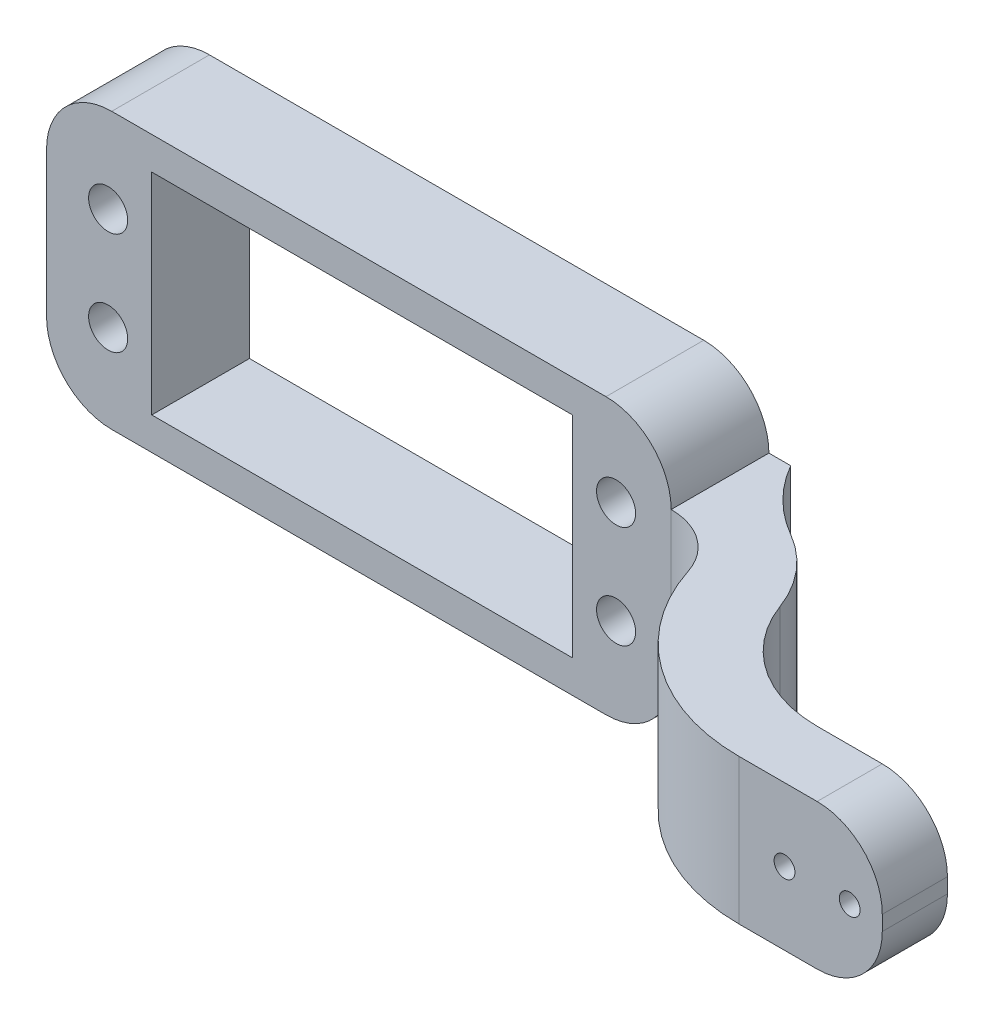
from build123d import *

# Parameters (mm, degrees)
BOSS_EXTRUDE1_DEPTH      = 15.1765
SKETCH3_W                = 41
SKETCH3_H                = 20.5
CUT_EXTRUDE1_DEPTH       = 27.178
SKETCH4_R                = 1.905
CUT_EXTRUDE2_DEPTH       = 12.7
SKETCH5_W                = 6.35
SKETCH5_H                = 9.525
CUT_EXTRUDE3_DEPTH       = 10.25
BOSS_EXTRUDE2_DEPTH      = 17.526
BOSS_EXTRUDE2_DEPTH_BACK = 1.5875
SKETCH7_W                = 38.1
SKETCH7_H                = 14.15
SKETCH7_R                = 1.016
FILLET3_R                = 15.875
FILLET4_R                = 6.35
CUT_EXTRUDE4_DEPTH       = 79.37799596
SKETCH11_W               = 161.059050972
SKETCH11_H               = 91.650514338
CUT_EXTRUDE5_DEPTH       = 20.828


with BuildPart() as part:
    # Sketch2 → Boss-Extrude1 (new, symmetric)
    with BuildSketch(Plane.XY):
        with BuildLine():
            Line((23.765883374, 13.425), (-24.4, 13.425))
            ThreePointArc((-24.4, 13.425), (-28.890128061, 11.565128061), (-30.75, 7.075))
            Line((-30.75, 7.075), (-30.75, -7.075))
            ThreePointArc((-30.75, -7.075), (-28.890128061, -11.565128061), (-24.4, -13.425))
            Line((-24.4, -13.425), (23.765883374, -13.425))
            ThreePointArc((23.765883374, -13.425), (28.256011435, -11.565128061), (30.115883374, -7.075))
            Line((30.115883374, -7.075), (30.115883374, 7.075))
            ThreePointArc((30.115883374, 7.075), (28.256011435, 11.565128061), (23.765883374, 13.425))
        make_face()
    extrude(amount=BOSS_EXTRUDE1_DEPTH, both=True)

    # Sketch3 → Cut-Extrude1 (cut)
    with BuildSketch(Plane.XY.offset(15.1765)):
        Rectangle(SKETCH3_W, SKETCH3_H)
    extrude(amount=-CUT_EXTRUDE1_DEPTH, mode=Mode.SUBTRACT)

    # Sketch4 → Cut-Extrude2 (cut)
    with BuildSketch(Plane.XY.offset(15.1765)):
        with Locations((-24.75, 5)):
            Circle(SKETCH4_R)
        with Locations((-24.75, -5)):
            Circle(SKETCH4_R)
        with Locations((24.75, -5)):
            Circle(SKETCH4_R)
        with Locations((24.75, 5)):
            Circle(SKETCH4_R)
    extrude(amount=-CUT_EXTRUDE2_DEPTH, mode=Mode.SUBTRACT)

    # Sketch5 → Cut-Extrude3 (cut)
    with BuildSketch(Plane.ZY.offset(30.75)):
        with Locations((-7.1755, 0)):
            Rectangle(SKETCH5_W, SKETCH5_H)
    extrude(amount=-CUT_EXTRUDE3_DEPTH, mode=Mode.SUBTRACT)


with BuildPart() as body_2:
    # Sketch7 → Boss-Extrude2 (new, two sides: drawn at the far end of the back side and taken through both)
    with BuildSketch(Plane.XY.offset(15.1765).offset(-BOSS_EXTRUDE2_DEPTH_BACK)):
        with Locations((49.165883374, 0)):
            Rectangle(SKETCH7_W, SKETCH7_H)
        with Locations((65.040883374, 0)):
            Circle(SKETCH7_R, mode=Mode.SUBTRACT)
        with Locations((58.690883374, 0)):
            Circle(SKETCH7_R, mode=Mode.SUBTRACT)
    extrude(amount=BOSS_EXTRUDE2_DEPTH + BOSS_EXTRUDE2_DEPTH_BACK)

    # Combine1: union part
    add(part.part)

    # Fillet3
    # the kernel refuses this fillet: 15.875 mm, written as the material it adds along each edge
    with BuildSketch(Plane(origin=(30.115883374, -7.075, 13.589), x_dir=(1, 0, 0), z_dir=(0, 1, 0))) as fillet3_piece_1:
        with BuildLine():
            CenterArc((FILLET3_R, FILLET3_R), FILLET3_R, 180, 90)
            Line((0, FILLET3_R), (0, 0))
            Line((0, 0), (FILLET3_R, 0))
        make_face()
    extrude(amount=14.15)

    # Fillet4
    fillet4_edges = [body_2.edges().sort_by_distance(p)[0] for p in [
        (68.215883374, -7.075, 23.14575),
        (68.215883374, 7.075, 23.14575),
    ]]
    fillet(fillet4_edges, radius=FILLET4_R)

    # Sketch9 → Cut-Extrude4 (cut, through all)
    with BuildSketch(Plane(origin=(0, 7.075, 0), x_dir=(1, 0, 0), z_dir=(0, 1, 0))):
        with BuildLine():
            Line((54.264591911, -32.7025), (24.88975776, -36.85029523))
            Line((24.88975776, -36.85029523), (30.115883374, -15.1765))
            ThreePointArc((30.115883374, -15.1765), (33.845663864, -16.387313537), (36.153060508, -19.558))
            ThreePointArc((36.153060508, -19.558), (43.075250443, -29.070059389), (54.264591911, -32.7025))
        make_face()
        with BuildLine():
            Line((59.502916407, -4.726647085), (70.262240595, -12.045992063))
            Line((70.262240595, -12.045992063), (68.215883374, -26.3525))
            Line((68.215883374, -26.3525), (55.515883374, -26.3525))
            ThreePointArc((55.515883374, -26.3525), (48.256026462, -24.072887594), (43.6024152, -18.052417734))
            ThreePointArc((43.6024152, -18.052417734), (41.400812879, -14.268836115), (38.045363181, -11.457519704))
            Line((38.045363181, -11.457519704), (42.798116213, -7.288485815))
            Line((42.798116213, -7.288485815), (59.502916407, -4.726647085))
        make_face()
    extrude(amount=-CUT_EXTRUDE4_DEPTH, mode=Mode.SUBTRACT)

    # Sketch11 → Cut-Extrude5 (cut)
    with BuildSketch(Plane(origin=(0, 0, -15.1765), x_dir=(-1, 0, 0), z_dir=(0, 0, -1))):
        Rectangle(SKETCH11_W, SKETCH11_H)
    extrude(amount=-CUT_EXTRUDE5_DEPTH, mode=Mode.SUBTRACT)


solid = body_2.part
